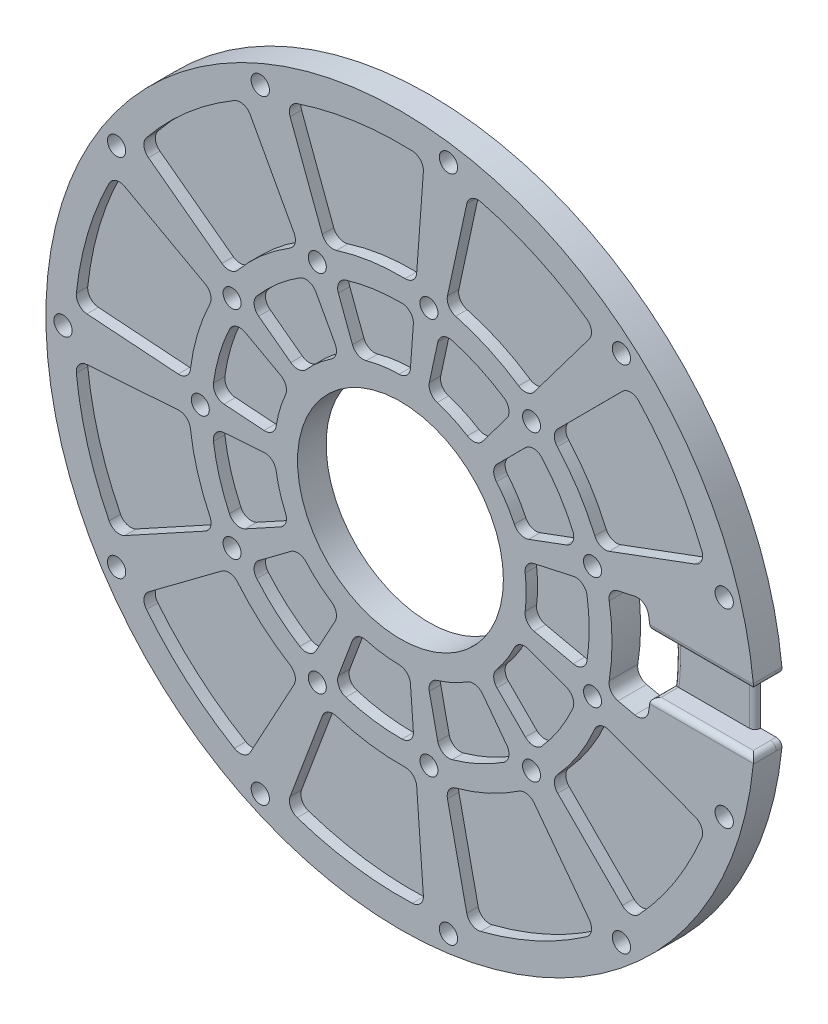
from build123d import *

# Parameters (mm, degrees)
SKETCH1_R           = 62
SKETCH1_R_2         = 18
BOSS_EXTRUDE1_DEPTH = 5
SKETCH2_R           = 1.575
CUT_EXTRUDE1_DEPTH  = 187.508589815
SKETCH4_R           = 1.6
CUT_EXTRUDE3_DEPTH  = 187.508589815
CUT_EXTRUDE2_DEPTH  = 2
CUT_EXTRUDE5_DEPTH  = 187.508589815
CUT_EXTRUDE6_DEPTH  = 4
FILLET1_R           = 1
SKETCH8_W           = 8
SKETCH8_H           = 10
CUT_EXTRUDE7_DEPTH  = 187.484460681
FILLET2_R           = 1
FILLET3_R           = 1


with BuildPart() as part:
    # Sketch1 → Boss-Extrude1 (new body)
    with BuildSketch(Plane.XY.offset(-61.995840519)):
        with Locations((89.072792821, 47.25870832)):
            Circle(SKETCH1_R)
        with Locations((89.072792821, 47.25870832)):
            Circle(SKETCH1_R_2, mode=Mode.SUBTRACT)
    extrude(amount=BOSS_EXTRUDE1_DEPTH)

    # Sketch2 → Cut-Extrude1 (cut, through all)
    with BuildSketch(Plane.XY.offset(-56.995840519)):
        with Locations((54.072792821, 47.25870832)):
            Circle(SKETCH2_R)
        with Locations((59.628919172, 66.181136931)):
            Circle(SKETCH2_R)
        with Locations((74.533267366, 79.095828158)):
            Circle(SKETCH2_R)
        with Locations((94.053812161, 81.902458786)):
            Circle(SKETCH2_R)
        with Locations((111.992918509, 73.709943423)):
            Circle(SKETCH2_R)
        with Locations((122.655046898, 57.11934781)):
            Circle(SKETCH2_R)
        with Locations((122.655046898, 37.398068831)):
            Circle(SKETCH2_R)
        with Locations((111.992918509, 20.807473218)):
            Circle(SKETCH2_R)
        with Locations((94.053812161, 12.614957855)):
            Circle(SKETCH2_R)
        with Locations((74.533267366, 15.421588483)):
            Circle(SKETCH2_R)
        with Locations((59.628919172, 28.33627971)):
            Circle(SKETCH2_R)
    extrude(amount=-CUT_EXTRUDE1_DEPTH, mode=Mode.SUBTRACT)

    # Sketch4 → Cut-Extrude3 (cut, through all)
    with BuildSketch(Plane.XY.offset(-56.995840519)):
        with Locations((30.072792821, 47.25870832)):
            Circle(SKETCH4_R)
        with Locations((39.438834384, 79.15651655)):
            Circle(SKETCH4_R)
        with Locations((64.563307054, 100.926996046)):
            Circle(SKETCH4_R)
        with Locations((97.469368279, 105.658173391)):
            Circle(SKETCH4_R)
        with Locations((127.709576124, 91.847933207)):
            Circle(SKETCH4_R)
        with Locations((145.682878264, 63.880929174)):
            Circle(SKETCH4_R)
        with Locations((145.682878264, 30.636487467)):
            Circle(SKETCH4_R)
        with Locations((127.709576124, 2.669483434)):
            Circle(SKETCH4_R)
        with Locations((97.469368279, -11.14075675)):
            Circle(SKETCH4_R)
        with Locations((64.563307054, -6.409579405)):
            Circle(SKETCH4_R)
        with Locations((39.438834384, 15.360900091)):
            Circle(SKETCH4_R)
    extrude(amount=-CUT_EXTRUDE3_DEPTH, mode=Mode.SUBTRACT)

    # Sketch3 → Cut-Extrude2 (cut)
    with BuildSketch(Plane.XY.offset(-56.995840519)):
        with BuildLine():
            Line((78.215997152, 76.226448788), (80.679280936, 69.653997071))
            ThreePointArc((80.679280936, 69.653997071), (81.648923359, 68.571429294), (83.09546271, 68.431132007))
            ThreePointArc((83.09546271, 68.431132007), (85.941866379, 69.034780042), (88.843038004, 69.257508577))
            ThreePointArc((88.843038004, 69.257508577), (90.191456034, 69.799660068), (90.816826538, 71.111556083))
            Line((90.816826538, 71.111556083), (91.328656394, 78.111764564))
            ThreePointArc((91.328656394, 78.111764564), (90.804574217, 79.613098956), (89.350831912, 80.257537001))
            ThreePointArc((89.350831912, 80.257537001), (84.376403158, 79.922815903), (79.50917189, 78.842519913))
            ThreePointArc((79.50917189, 78.842519913), (78.295875541, 77.8146196), (78.215997152, 76.226448788))
        make_face()
        with BuildLine():
            Line((75.403737986, 83.730024994), (69.783288936, 98.726319882))
            ThreePointArc((69.783288936, 98.726319882), (69.850854152, 100.289133051), (71.022741946, 101.325293781))
            ThreePointArc((71.022741946, 101.325293781), (80.96084704, 103.678530508), (91.159372448, 104.220504162))
            ThreePointArc((91.159372448, 104.220504162), (92.575710764, 103.556474166), (93.080834464, 102.076001232))
            Line((93.080834464, 102.076001232), (91.912997594, 86.103698176))
            ThreePointArc((91.912997594, 86.103698176), (91.264036124, 84.769996337), (89.874961774, 84.25001169))
            ThreePointArc((89.874961774, 84.25001169), (83.807143805, 83.88210167), (77.881462868, 82.525606878))
            ThreePointArc((77.881462868, 82.525606878), (76.402159185, 82.633181025), (75.403737986, 83.730024994))
        make_face()
        with BuildLine():
            Line((127.118193407, 55.598222352), (130.052203138, 56.241354372))
            ThreePointArc((130.052203138, 56.241354372), (131.598850611, 55.945791996), (132.452226422, 54.622453321))
            ThreePointArc((132.452226422, 54.622453321), (133.072792821, 47.25870832), (132.452226422, 39.89496332))
            ThreePointArc((132.452226422, 39.89496332), (131.598850611, 38.571624645), (130.052203138, 38.276062269))
            Line((130.052203138, 38.276062269), (127.118193407, 38.919194289))
            ThreePointArc((127.118193407, 38.919194289), (125.890423576, 39.751355828), (125.573417515, 41.200292935))
            ThreePointArc((125.573417515, 41.200292935), (126.072792821, 47.25870832), (125.573417515, 53.317123706))
            ThreePointArc((125.573417515, 53.317123706), (125.890423576, 54.766060813), (127.118193407, 55.598222352))
        make_face()
        with BuildLine():
            Line((122.081038063, 91.207038733), (112.463312189, 78.401662639))
            ThreePointArc((112.463312189, 78.401662639), (111.196317408, 77.630536315), (109.746628779, 77.944087686))
            ThreePointArc((109.746628779, 77.944087686), (104.443148302, 80.915092149), (98.724771827, 82.977601098))
            ThreePointArc((98.724771827, 82.977601098), (97.538461352, 83.867870182), (97.291534611, 85.330381299))
            Line((97.291534611, 85.330381299), (100.670921119, 100.984711522))
            ThreePointArc((100.670921119, 100.984711522), (101.572681184, 102.262905108), (103.118726715, 102.501008608))
            ThreePointArc((103.118726715, 102.501008608), (112.751448562, 99.107732056), (121.624007171, 94.049930193))
            ThreePointArc((121.624007171, 94.049930193), (122.456505064, 92.725582309), (122.081038063, 91.207038733))
        make_face()
        with BuildLine():
            Line((140.601357024, 66.384791852), (125.587302155, 60.811959152))
            ThreePointArc((125.587302155, 60.811959152), (124.104535953, 60.848235502), (123.054498942, 61.895772546))
            ThreePointArc((123.054498942, 61.895772546), (120.199173536, 67.262418566), (116.503645648, 72.089099239))
            ThreePointArc((116.503645648, 72.089099239), (115.986973576, 73.479409116), (116.569938788, 74.843250435))
            Line((116.569938788, 74.843250435), (127.876229515, 86.185476755))
            ThreePointArc((127.876229515, 86.185476755), (129.325881981, 86.773233326), (130.755226717, 86.137683417))
            ThreePointArc((130.755226717, 86.137683417), (137.024244193, 78.075234915), (141.753861334, 69.023473891))
            ThreePointArc((141.753861334, 69.023473891), (141.738206604, 67.459279214), (140.601357024, 66.384791852))
        make_face()
        with BuildLine():
            Line((127.876229515, 8.331939886), (116.569938788, 19.674166206))
            ThreePointArc((116.569938788, 19.674166206), (115.986973576, 21.038007525), (116.503645648, 22.428317402))
            ThreePointArc((116.503645648, 22.428317402), (120.199173536, 27.254998075), (123.054498942, 32.621644095))
            ThreePointArc((123.054498942, 32.621644095), (124.104535953, 33.669181139), (125.587302155, 33.705457489))
            Line((125.587302155, 33.705457489), (140.601357024, 28.132624789))
            ThreePointArc((140.601357024, 28.132624789), (141.738206604, 27.058137428), (141.753861334, 25.49394275))
            ThreePointArc((141.753861334, 25.49394275), (137.024244193, 16.442181726), (130.755226717, 8.379733224))
            ThreePointArc((130.755226717, 8.379733224), (129.325881981, 7.744183315), (127.876229515, 8.331939886))
        make_face()
        with BuildLine():
            Line((100.670921119, -6.467294881), (97.291534611, 9.187035342))
            ThreePointArc((97.291534611, 9.187035342), (97.538461352, 10.649546459), (98.724771827, 11.539815543))
            ThreePointArc((98.724771827, 11.539815543), (104.443148302, 13.602324492), (109.746628779, 16.573328955))
            ThreePointArc((109.746628779, 16.573328955), (111.196317408, 16.886880326), (112.463312189, 16.115754002))
            Line((112.463312189, 16.115754002), (122.081038063, 3.310377908))
            ThreePointArc((122.081038063, 3.310377908), (122.456505064, 1.791834332), (121.624007171, 0.467486448))
            ThreePointArc((121.624007171, 0.467486448), (112.751448562, -4.590315415), (103.118726715, -7.983591967))
            ThreePointArc((103.118726715, -7.983591967), (101.572681184, -7.745488467), (100.670921119, -6.467294881))
        make_face()
        with BuildLine():
            Line((69.783288936, -4.208903241), (75.403737986, 10.787391647))
            ThreePointArc((75.403737986, 10.787391647), (76.402159185, 11.884235616), (77.881462868, 11.991809763))
            ThreePointArc((77.881462868, 11.991809763), (83.807143805, 10.635314971), (89.874961774, 10.267404951))
            ThreePointArc((89.874961774, 10.267404951), (91.264036124, 9.747420304), (91.912997594, 8.413718465))
            Line((91.912997594, 8.413718465), (93.080834464, -7.558584591))
            ThreePointArc((93.080834464, -7.558584591), (92.575710764, -9.039057525), (91.159372448, -9.703087521))
            ThreePointArc((91.159372448, -9.703087521), (80.96084704, -9.161113867), (71.022741946, -6.80787714))
            ThreePointArc((71.022741946, -6.80787714), (69.850854152, -5.77171641), (69.783288936, -4.208903241))
        make_face()
        with BuildLine():
            Line((45.019937944, 14.390091416), (57.855769691, 23.967133302))
            ThreePointArc((57.855769691, 23.967133302), (59.288693672, 24.350069912), (60.591322096, 23.640795091))
            ThreePointArc((60.591322096, 23.640795091), (64.842945665, 19.295974069), (69.748611794, 15.705958399))
            ThreePointArc((69.748611794, 15.705958399), (70.636050574, 14.517529185), (70.460938051, 13.044692742))
            Line((70.460938051, 13.044692742), (62.808105962, -1.023443912))
            ThreePointArc((62.808105962, -1.023443912), (61.582764768, -1.995806508), (60.032263436, -1.788693783))
            ThreePointArc((60.032263436, -1.788693783), (51.745730986, 4.180982582), (44.657520794, 11.533596554))
            ThreePointArc((44.657520794, 11.533596554), (44.231856831, 13.038840803), (45.019937944, 14.390091416))
        make_face()
        with BuildLine():
            Line((34.243057113, 43.424639703), (50.21898567, 44.541785455))
            ThreePointArc((50.21898567, 44.541785455), (51.631469194, 44.089235038), (52.343847038, 42.788300993))
            ThreePointArc((52.343847038, 42.788300993), (53.571552797, 36.834603717), (55.757552752, 31.162287005))
            ThreePointArc((55.757552752, 31.162287005), (55.861600419, 29.682731104), (54.918010892, 28.53837522))
            Line((54.918010892, 28.53837522), (40.874229961, 20.840938956))
            ThreePointArc((40.874229961, 20.840938956), (39.317708444, 20.685404952), (38.125317314, 21.697903571))
            ThreePointArc((38.125317314, 21.697903571), (34.381693325, 31.199952581), (32.393834687, 41.217540812))
            ThreePointArc((32.393834687, 41.217540812), (32.849539856, 42.713964168), (34.243057113, 43.424639703))
        make_face()
        with BuildLine():
            Line((40.874229961, 73.676477685), (54.918010892, 65.979041421))
            ThreePointArc((54.918010892, 65.979041421), (55.861600419, 64.834685537), (55.757552752, 63.355129636))
            ThreePointArc((55.757552752, 63.355129636), (53.571552797, 57.682812924), (52.343847038, 51.729115648))
            ThreePointArc((52.343847038, 51.729115648), (51.631469194, 50.428181603), (50.21898567, 49.975631186))
            Line((50.21898567, 49.975631186), (34.243057113, 51.092776938))
            ThreePointArc((34.243057113, 51.092776938), (32.849539856, 51.803452473), (32.393834687, 53.299875829))
            ThreePointArc((32.393834687, 53.299875829), (34.381693325, 63.31746406), (38.125317314, 72.81951307))
            ThreePointArc((38.125317314, 72.81951307), (39.317708444, 73.832011689), (40.874229961, 73.676477685))
        make_face()
        with BuildLine():
            Line((62.808105962, 95.540860553), (70.460938051, 81.472723899))
            ThreePointArc((70.460938051, 81.472723899), (70.636050574, 79.999887456), (69.748611794, 78.811458242))
            ThreePointArc((69.748611794, 78.811458242), (64.842945665, 75.221442572), (60.591322096, 70.87662155))
            ThreePointArc((60.591322096, 70.87662155), (59.288693672, 70.167346729), (57.855769691, 70.550283339))
            Line((57.855769691, 70.550283339), (45.019937944, 80.127325224))
            ThreePointArc((45.019937944, 80.127325224), (44.231856831, 81.478575838), (44.657520794, 82.983820087))
            ThreePointArc((44.657520794, 82.983820087), (51.745730986, 90.336434059), (60.032263436, 96.306110423))
            ThreePointArc((60.032263436, 96.306110423), (61.582764768, 96.513223149), (62.808105962, 95.540860553))
        make_face()
        with BuildLine():
            Line((95.600617996, 77.497549212), (94.119528512, 70.636699228))
            ThreePointArc((94.119528512, 70.636699228), (94.349963298, 69.201756988), (95.491019197, 68.301673182))
            ThreePointArc((95.491019197, 68.301673182), (98.211923107, 67.270612218), (100.772960123, 65.889491586))
            ThreePointArc((100.772960123, 65.889491586), (102.20043078, 65.616568618), (103.43579046, 66.382104954))
            Line((103.43579046, 66.382104954), (107.650967569, 71.994338958))
            ThreePointArc((107.650967569, 71.994338958), (108.02176424, 73.540682035), (107.147207901, 74.868770246))
            ThreePointArc((107.147207901, 74.868770246), (102.78148825, 77.276564167), (98.102860644, 78.999185241))
            ThreePointArc((98.102860644, 78.999185241), (96.526445938, 78.790418001), (95.600617996, 77.497549212))
        make_face()
        with BuildLine():
            Line((110.91270047, 69.168031311), (105.957473165, 64.197054453))
            ThreePointArc((105.957473165, 64.197054453), (105.375538897, 62.865321773), (105.848834159, 61.491221697))
            ThreePointArc((105.848834159, 61.491221697), (107.580370543, 59.152806304), (108.988161794, 56.606332548))
            ThreePointArc((108.988161794, 56.606332548), (110.04147323, 55.604986233), (111.494604116, 55.581110514))
            Line((111.494604116, 55.581110514), (118.07483953, 58.023525398))
            ThreePointArc((118.07483953, 58.023525398), (119.222789725, 59.12392416), (119.20508481, 60.714003913))
            ThreePointArc((119.20508481, 60.714003913), (116.834159405, 65.099855297), (113.829566667, 69.078473414))
            ThreePointArc((113.829566667, 69.078473414), (112.390534136, 69.755121371), (110.91270047, 69.168031311))
        make_face()
        with BuildLine():
            Line((119.290766579, 53.882458164), (112.43465111, 52.379604461))
            ThreePointArc((112.43465111, 52.379604461), (111.225107807, 51.573897057), (110.88037453, 50.162047777))
            ThreePointArc((110.88037453, 50.162047777), (111.072792821, 47.25870832), (110.88037453, 44.355368864))
            ThreePointArc((110.88037453, 44.355368864), (111.225107807, 42.943519584), (112.43465111, 42.13781218))
            Line((112.43465111, 42.13781218), (119.290766579, 40.634958477))
            ThreePointArc((119.290766579, 40.634958477), (120.851404222, 40.940044091), (121.696171918, 42.2872763))
            ThreePointArc((121.696171918, 42.2872763), (122.072792821, 47.25870832), (121.696171918, 52.230140341))
            ThreePointArc((121.696171918, 52.230140341), (120.851404222, 53.57737255), (119.290766579, 53.882458164))
        make_face()
        with BuildLine():
            Line((118.07483953, 36.493891243), (111.494604116, 38.936306127))
            ThreePointArc((111.494604116, 38.936306127), (110.04147323, 38.912430408), (108.988161794, 37.911084093))
            ThreePointArc((108.988161794, 37.911084093), (107.580370543, 35.364610336), (105.848834159, 33.026194944))
            ThreePointArc((105.848834159, 33.026194944), (105.375538897, 31.652094868), (105.957473165, 30.320362188))
            Line((105.957473165, 30.320362188), (110.91270047, 25.34938533))
            ThreePointArc((110.91270047, 25.34938533), (112.390534136, 24.76229527), (113.829566667, 25.438943227))
            ThreePointArc((113.829566667, 25.438943227), (116.834159405, 29.417561344), (119.20508481, 33.803412728))
            ThreePointArc((119.20508481, 33.803412728), (119.222789725, 35.393492481), (118.07483953, 36.493891243))
        make_face()
        with BuildLine():
            Line((107.650967569, 22.523077683), (103.43579046, 28.135311687))
            ThreePointArc((103.43579046, 28.135311687), (102.20043078, 28.900848023), (100.772960123, 28.627925055))
            ThreePointArc((100.772960123, 28.627925055), (98.211923107, 27.246804423), (95.491019197, 26.215743458))
            ThreePointArc((95.491019197, 26.215743458), (94.349963298, 25.315659653), (94.119528512, 23.880717413))
            Line((94.119528512, 23.880717413), (95.600617996, 17.019867429))
            ThreePointArc((95.600617996, 17.019867429), (96.526445938, 15.72699864), (98.102860644, 15.5182314))
            ThreePointArc((98.102860644, 15.5182314), (102.78148825, 17.240852474), (107.147207901, 19.648646395))
            ThreePointArc((107.147207901, 19.648646395), (108.02176424, 20.976734606), (107.650967569, 22.523077683))
        make_face()
        with BuildLine():
            Line((91.328656394, 16.405652077), (90.816826538, 23.405860558))
            ThreePointArc((90.816826538, 23.405860558), (90.191456034, 24.717756573), (88.843038004, 25.259908064))
            ThreePointArc((88.843038004, 25.259908064), (85.941866379, 25.482636599), (83.09546271, 26.086284634))
            ThreePointArc((83.09546271, 26.086284634), (81.648923359, 25.945987347), (80.679280936, 24.86341957))
            Line((80.679280936, 24.86341957), (78.215997152, 18.290967853))
            ThreePointArc((78.215997152, 18.290967853), (78.295875541, 16.702797041), (79.50917189, 15.674896728))
            ThreePointArc((79.50917189, 15.674896728), (84.376403158, 14.594600738), (89.350831912, 14.25987964))
            ThreePointArc((89.350831912, 14.25987964), (90.804574217, 14.904317685), (91.328656394, 16.405652077))
        make_face()
        with BuildLine():
            Line((74.290124473, 20.083853831), (77.644144234, 26.249520057))
            ThreePointArc((77.644144234, 26.249520057), (77.827313622, 27.691258036), (76.986061416, 28.876354719))
            ThreePointArc((76.986061416, 28.876354719), (74.665856674, 30.632217685), (72.597666299, 32.678920733))
            ThreePointArc((72.597666299, 32.678920733), (71.30490952, 33.342953362), (69.903914077, 32.956467667))
            Line((69.903914077, 32.956467667), (64.278332223, 28.759121199))
            ThreePointArc((64.278332223, 28.759121199), (63.486900234, 27.379881376), (63.951865209, 25.859199076))
            ThreePointArc((63.951865209, 25.859199076), (67.462388601, 22.318972367), (71.466180476, 19.348007833))
            ThreePointArc((71.466180476, 19.348007833), (73.037555837, 19.104191186), (74.290124473, 20.083853831))
        make_face()
        with BuildLine():
            Line((61.944985303, 32.389879877), (68.099977105, 35.763448387))
            ThreePointArc((68.099977105, 35.763448387), (69.033531399, 36.877286707), (68.966536648, 38.329068759))
            ThreePointArc((68.966536648, 38.329068759), (67.963947402, 41.06059207), (67.330606151, 43.900536376))
            ThreePointArc((67.330606151, 43.900536376), (66.602073087, 45.158073252), (65.214530779, 45.590376117))
            Line((65.214530779, 45.590376117), (58.212733345, 45.100762745))
            ThreePointArc((58.212733345, 45.100762745), (56.801265042, 44.368352808), (56.370275548, 42.837694407))
            ThreePointArc((56.370275548, 42.837694407), (57.409524692, 37.961533945), (59.171504057, 33.297586222))
            ThreePointArc((59.171504057, 33.297586222), (60.3616119, 32.242924947), (61.944985303, 32.389879877))
        make_face()
        with BuildLine():
            Line((58.212733345, 49.416653896), (65.214530779, 48.927040524))
            ThreePointArc((65.214530779, 48.927040524), (66.602073087, 49.359343389), (67.330606151, 50.616880265))
            ThreePointArc((67.330606151, 50.616880265), (67.963947402, 53.456824571), (68.966536648, 56.188347882))
            ThreePointArc((68.966536648, 56.188347882), (69.033531399, 57.640129934), (68.099977105, 58.753968254))
            Line((68.099977105, 58.753968254), (61.944985303, 62.127536764))
            ThreePointArc((61.944985303, 62.127536764), (60.3616119, 62.274491694), (59.171504057, 61.219830419))
            ThreePointArc((59.171504057, 61.219830419), (57.409524692, 56.555882696), (56.370275548, 51.679722234))
            ThreePointArc((56.370275548, 51.679722234), (56.801265042, 50.149063833), (58.212733345, 49.416653896))
        make_face()
        with BuildLine():
            Line((64.278332223, 65.758295442), (69.903914077, 61.560948974))
            ThreePointArc((69.903914077, 61.560948974), (71.30490952, 61.174463279), (72.597666299, 61.838495908))
            ThreePointArc((72.597666299, 61.838495908), (74.665856674, 63.885198956), (76.986061416, 65.641061922))
            ThreePointArc((76.986061416, 65.641061922), (77.827313622, 66.826158605), (77.644144234, 68.267896584))
            Line((77.644144234, 68.267896584), (74.290124473, 74.43356281))
            ThreePointArc((74.290124473, 74.43356281), (73.037555838, 75.413225455), (71.466180476, 75.169408808))
            ThreePointArc((71.466180476, 75.169408808), (67.462388601, 72.198444274), (63.951865209, 68.658217565))
            ThreePointArc((63.951865209, 68.658217565), (63.486900234, 67.137535265), (64.278332223, 65.758295442))
        make_face()
    extrude(amount=-CUT_EXTRUDE2_DEPTH, mode=Mode.SUBTRACT)

    # Sketch3<3> → Cut-Extrude5 (cut, through all)
    with BuildSketch(Plane.XY.offset(-56.995840519)):
        with BuildLine():
            ThreePointArc((132.452226422, 39.89496332), (131.598850611, 38.571624645), (130.052203138, 38.276062269))
            Line((130.052203138, 38.276062269), (127.118193407, 38.919194289))
            ThreePointArc((127.118193407, 38.919194289), (125.890423576, 39.751355828), (125.573417515, 41.200292935))
            ThreePointArc((125.573417515, 41.200292935), (126.072792821, 47.25870832), (125.573417515, 53.317123706))
            ThreePointArc((125.573417515, 53.317123706), (125.890423576, 54.766060813), (127.118193407, 55.598222352))
            Line((127.118193407, 55.598222352), (130.052203138, 56.241354372))
            ThreePointArc((130.052203138, 56.241354372), (131.598850611, 55.945791996), (132.452226422, 54.622453321))
            ThreePointArc((132.452226422, 54.622453321), (133.072792821, 47.25870832), (132.452226422, 39.89496332))
        make_face()
    extrude(amount=-CUT_EXTRUDE5_DEPTH, mode=Mode.SUBTRACT)

    # Sketch7 → Cut-Extrude6 (cut)
    with BuildSketch(Plane.XY.offset(-56.995840519)):
        Polygon((132.78777881, 52.25870832), (151.072792821, 52.25870832), (151.072792821, 47.25870832), (151.072792821, 42.25870832), (132.78777881, 42.25870832), align=None)
    extrude(amount=-CUT_EXTRUDE6_DEPTH, mode=Mode.SUBTRACT)

    # Fillet1
    fillet1_edges = [part.edges().sort_by_distance(p)[0] for p in [
        (133.072792821, 47.25870832, -60.995840519),
        (150.870851043, 42.25870832, -58.995840519),
        (132.78777881, 52.25870832, -58.995840519),
        (141.829314927, 52.25870832, -56.995840519),
        (141.829314927, 42.25870832, -56.995840519),
        (132.78777881, 42.25870832, -58.995840519),
        (150.870851043, 52.25870832, -58.995840519),
    ]]
    fillet(fillet1_edges, radius=FILLET1_R - 0.0001)  # a hair under: the kernel refuses the full size

    # Sketch8 → Cut-Extrude7 (cut, through all)
    with BuildSketch(Plane.XY.offset(-60.995840519)):
        with Locations((151.072792821, 47.25870832)):
            Rectangle(SKETCH8_W, SKETCH8_H)
    extrude(amount=-CUT_EXTRUDE7_DEPTH, mode=Mode.SUBTRACT)

    # Fillet2
    fillet2_edges = [part.edges().sort_by_distance(p)[0] for p in [
        (150.870851043, 42.25870832, -61.495840519),
        (150.870851043, 52.25870832, -61.495840519),
    ]]
    fillet(fillet2_edges, radius=FILLET2_R - 0.0001)  # a hair under: the kernel refuses the full size

    # Fillet3
    fillet3_edges = [part.edges().sort_by_distance(p)[0] for p in [
        (147.072792821, 47.25870832, -60.995840519),
    ]]
    fillet(fillet3_edges, radius=FILLET3_R - 0.0001)  # a hair under: the kernel refuses the full size


solid = part.part
